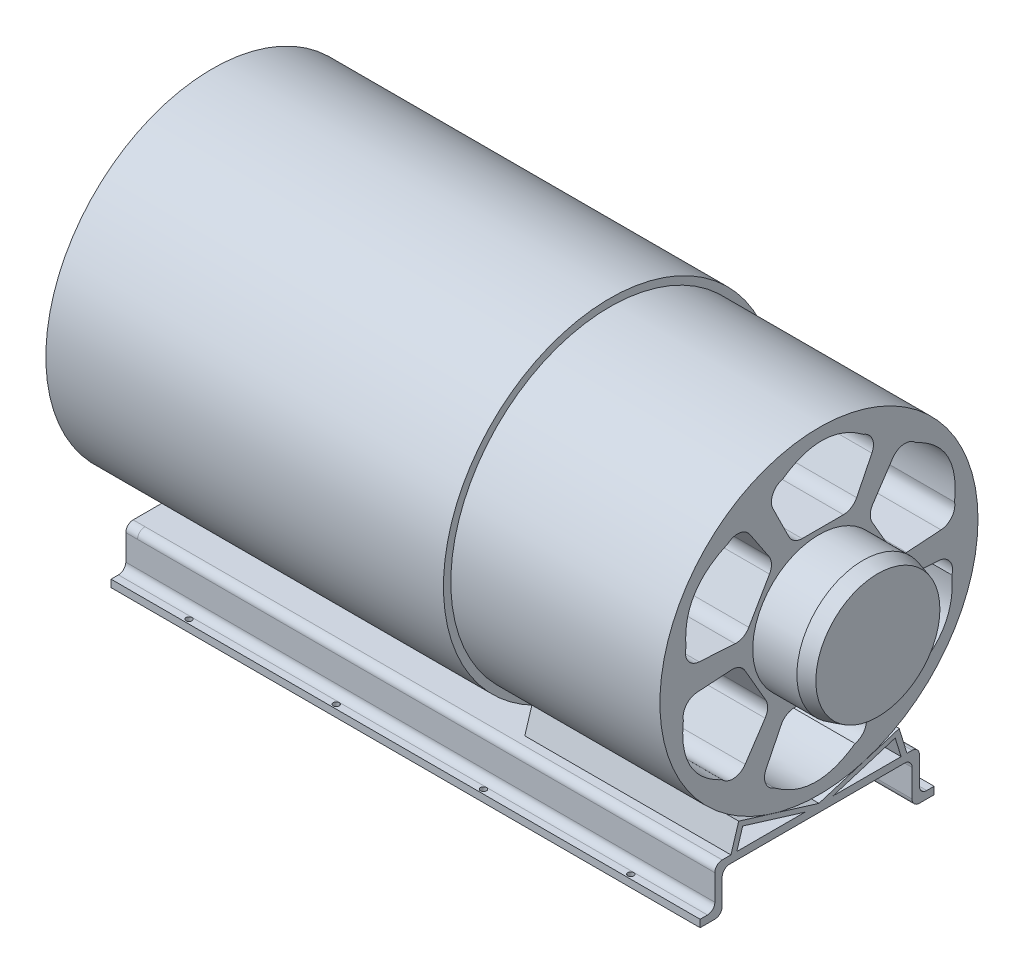
from build123d import *

# Parameters (mm, degrees)
SKETCH1_R           = 113
BOSS_EXTRUDE1_DEPTH = 412
SKETCH2_R           = 113
SKETCH2_R_2         = 108
CUT_EXTRUDE1_DEPTH  = 142
SKETCH3_R           = 45
BOSS_EXTRUDE2_DEPTH = 40
CHAMFER1_SIZE       = 10
CHAMFER1_SIZE2      = 2.867453858
CUT_EXTRUDE2_DEPTH  = 140
BOSS_EXTRUDE3_DEPTH = 140
SKETCH7_W           = 142
SKETCH7_H           = 138.914782262
BOSS_EXTRUDE4_DEPTH = 5
SKETCH8_W           = 250
SKETCH8_H           = 138.4150888
BOSS_EXTRUDE5_DEPTH = 5
BOSS_EXTRUDE6_DEPTH = 400
FILLET1_R           = 5
FILLET2_R           = 5
CUT_EXTRUDE3_REACH  = 502.151
SKETCH12_R          = 2


with BuildPart() as part:
    # Sketch1 → Boss-Extrude1 (new body)
    with BuildSketch(Plane(origin=(0, 0, 0), x_dir=(0, 0, -1), z_dir=(1, 0, 0))):
        Circle(SKETCH1_R)
    extrude(amount=-BOSS_EXTRUDE1_DEPTH)

    # Sketch2 → Cut-Extrude1 (cut)
    with BuildSketch(Plane(origin=(0, 0, 0), x_dir=(0, 0, -1), z_dir=(1, 0, 0))):
        Circle(SKETCH2_R)
        Circle(SKETCH2_R_2, mode=Mode.SUBTRACT)
    extrude(amount=-CUT_EXTRUDE1_DEPTH, mode=Mode.SUBTRACT)

    # Sketch3 → Boss-Extrude2 (add)
    with BuildSketch(Plane(origin=(0, 0, 0), x_dir=(0, 0, -1), z_dir=(1, 0, 0))):
        Circle(SKETCH3_R)
    extrude(amount=BOSS_EXTRUDE2_DEPTH)

    # Chamfer1
    chamfer1_edges = [part.edges().sort_by_distance(p)[0] for p in [
        (40, 0, 45),
    ]]
    chamfer1_side = [part.faces().sort_by_distance(p)[0] for p in [
        (20, 0, 45),
    ]]
    chamfer(chamfer1_edges, length=CHAMFER1_SIZE, length2=CHAMFER1_SIZE2, reference=chamfer1_side[0])

    # Sketch4 → Cut-Extrude2 (cut)
    with BuildSketch(Plane(origin=(0, 0, 0), x_dir=(0, 0, -1), z_dir=(1, 0, 0))):
        with BuildLine():
            Line((-31.240221824, 75.878671681), (-20.391979299, 53.964467826))
            ThreePointArc((-20.391979299, 53.964467826), (-16.704207466, 49.904928956), (-11.429970689, 48.400953109))
            Line((-11.429970689, 48.400953109), (16.62476497, 48.400953109))
            ThreePointArc((16.62476497, 48.400953109), (21.903878294, 49.907958201), (25.591861486, 53.974760608))
            Line((25.591861486, 53.974760608), (35.957582706, 74.974846485))
            ThreePointArc((35.957582706, 74.974846485), (36.256624475, 83.161182767), (30.33757525, 88.824254723))
            add(Edge.make_bspline(
                [(30.33757525, 88.824254723), (20.523446482, 96.066070343), (2.175661832, 102.649387038), (-16.006435429, 96.044513788), (-24.473320343, 90.07125786)],
                knots=[0.076116655, 0.076116655, 0.076116655, 0.076116655, 0.512928547, 0.896674248, 0.896674248, 0.896674248, 0.896674248], degree=3))
            ThreePointArc((-24.473320343, 90.07125786), (-31.304712176, 84.618913054), (-31.240221824, 75.878671681))
        make_face()
        with BuildLine():
            Line((50.092746369, 64.994161559), (36.538610389, 44.64220602))
            ThreePointArc((36.538610389, 44.64220602), (34.866832517, 39.418732494), (36.201469615, 34.099121536))
            Line((36.201469615, 34.099121536), (50.228837445, 9.803007759))
            ThreePointArc((50.228837445, 9.803007759), (54.173498801, 5.984664057), (59.539444593, 4.824178127))
            Line((59.539444593, 4.824178127), (82.908913054, 6.347243161))
            ThreePointArc((82.908913054, 6.347243161), (90.148009123, 10.181433532), (92.092848687, 18.139016506))
            add(Edge.make_bspline(
                [(92.092848687, 18.139016506), (93.4573806, 30.259209145), (89.984807774, 49.440515103), (75.17377112, 61.884236599), (65.767337287, 66.230146062)],
                knots=[0.076116655, 0.076116655, 0.076116655, 0.076116655, 0.512928547, 0.896674248, 0.896674248, 0.896674248, 0.896674248], degree=3))
            ThreePointArc((65.767337287, 66.230146062), (57.629772257, 69.42013253), (50.092746369, 64.994161559))
        make_face()
        with BuildLine():
            Line((81.332968193, -10.884510121), (56.930589688, -9.322261806))
            ThreePointArc((56.930589688, -9.322261806), (51.571039983, -10.486196462), (47.631440305, -14.301831573))
            Line((47.631440305, -14.301831573), (33.604072475, -38.59794535))
            ThreePointArc((33.604072475, -38.59794535), (32.269620506, -43.923294145), (33.947583107, -49.150582481))
            Line((33.947583107, -49.150582481), (46.951330348, -68.627603324))
            ThreePointArc((46.951330348, -68.627603324), (53.891384648, -72.979749235), (61.755273437, -70.685238217))
            add(Edge.make_bspline(
                [(61.755273437, -70.685238217), (72.933934118, -65.806861198), (87.809145942, -53.208871936), (91.180206549, -34.160277188), (90.240657629, -23.841111799)],
                knots=[0.076116655, 0.076116655, 0.076116655, 0.076116655, 0.512928547, 0.896674248, 0.896674248, 0.896674248, 0.896674248], degree=3))
            ThreePointArc((90.240657629, -23.841111799), (88.934484433, -15.198780524), (81.332968193, -10.884510121))
        make_face()
        with BuildLine():
            Line((31.240221824, -75.878671681), (20.391979299, -53.964467826))
            ThreePointArc((20.391979299, -53.964467826), (16.704207466, -49.904928956), (11.429970689, -48.400953109))
            Line((11.429970689, -48.400953109), (-16.62476497, -48.400953109))
            ThreePointArc((-16.62476497, -48.400953109), (-21.903878294, -49.907958201), (-25.591861486, -53.974760608))
            Line((-25.591861486, -53.974760608), (-35.957582706, -74.974846485))
            ThreePointArc((-35.957582706, -74.974846485), (-36.256624475, -83.161182767), (-30.33757525, -88.824254723))
            add(Edge.make_bspline(
                [(-30.33757525, -88.824254723), (-20.523446482, -96.066070343), (-2.175661832, -102.649387038), (16.006435429, -96.044513788), (24.473320343, -90.07125786)],
                knots=[0.076116655, 0.076116655, 0.076116655, 0.076116655, 0.512928547, 0.896674248, 0.896674248, 0.896674248, 0.896674248], degree=3))
            ThreePointArc((24.473320343, -90.07125786), (31.304712176, -84.618913054), (31.240221824, -75.878671681))
        make_face()
        with BuildLine():
            Line((-50.092746369, -64.994161559), (-36.538610389, -44.64220602))
            ThreePointArc((-36.538610389, -44.64220602), (-34.866832517, -39.418732494), (-36.201469615, -34.099121536))
            Line((-36.201469615, -34.099121536), (-50.228837445, -9.803007759))
            ThreePointArc((-50.228837445, -9.803007759), (-54.173498801, -5.984664057), (-59.539444593, -4.824178127))
            Line((-59.539444593, -4.824178127), (-82.908913054, -6.347243161))
            ThreePointArc((-82.908913054, -6.347243161), (-90.148009123, -10.181433532), (-92.092848687, -18.139016506))
            add(Edge.make_bspline(
                [(-92.092848687, -18.139016506), (-93.4573806, -30.259209145), (-89.984807774, -49.440515103), (-75.17377112, -61.884236599), (-65.767337287, -66.230146062)],
                knots=[0.076116655, 0.076116655, 0.076116655, 0.076116655, 0.512928547, 0.896674248, 0.896674248, 0.896674248, 0.896674248], degree=3))
            ThreePointArc((-65.767337287, -66.230146062), (-57.629772257, -69.42013253), (-50.092746369, -64.994161559))
        make_face()
        with BuildLine():
            Line((-81.332968193, 10.884510121), (-56.930589688, 9.322261806))
            ThreePointArc((-56.930589688, 9.322261806), (-51.571039983, 10.486196462), (-47.631440305, 14.301831573))
            Line((-47.631440305, 14.301831573), (-33.604072475, 38.59794535))
            ThreePointArc((-33.604072475, 38.59794535), (-32.269620506, 43.923294145), (-33.947583107, 49.150582481))
            Line((-33.947583107, 49.150582481), (-46.951330348, 68.627603324))
            ThreePointArc((-46.951330348, 68.627603324), (-53.891384648, 72.979749235), (-61.755273437, 70.685238217))
            add(Edge.make_bspline(
                [(-61.755273437, 70.685238217), (-72.933934118, 65.806861198), (-87.809145942, 53.208871936), (-91.180206549, 34.160277188), (-90.240657629, 23.841111799)],
                knots=[0.076116655, 0.076116655, 0.076116655, 0.076116655, 0.512928547, 0.896674248, 0.896674248, 0.896674248, 0.896674248], degree=3))
            ThreePointArc((-90.240657629, 23.841111799), (-88.934484433, 15.198780524), (-81.332968193, 10.884510121))
        make_face()
    extrude(amount=-CUT_EXTRUDE2_DEPTH, mode=Mode.SUBTRACT)


with BuildPart() as body_2:
    # Sketch5 → Boss-Extrude3 (new body)
    with BuildSketch(Plane(origin=(0, 0, 0), x_dir=(0, 0, -1), z_dir=(1, 0, 0))):
        Polygon((0, -113), (54.477876692, -96.232145303), (59.772988702, -113.435685311), (55.772988702, -113.435685311), (51.773497736, -100.44154983), (0, -116.377018316), (-51.773497736, -100.44154983), (-55.772988702, -113.435685311), (-59.772988702, -113.435685311), (-54.477876692, -96.232145303), align=None)
    extrude(amount=-BOSS_EXTRUDE3_DEPTH)

    # Sketch7 → Boss-Extrude4 (add)
    with BuildSketch(Plane.XZ.offset(113.435685311)):
        with Locations((-71, 1.249233653)):
            Rectangle(SKETCH7_W, SKETCH7_H)
    extrude(amount=BOSS_EXTRUDE4_DEPTH)

    # Sketch8 → Boss-Extrude5 (add)
    with BuildSketch(Plane.XZ.offset(118.435685311)):
        with Locations((-267, 1.499080384)):
            Rectangle(SKETCH8_W, SKETCH8_H)
    extrude(amount=-BOSS_EXTRUDE5_DEPTH)

    # Sketch11 → Boss-Extrude6 (add)
    with BuildSketch(Plane(origin=(0, 0, 0), x_dir=(0, 0, -1), z_dir=(1, 0, 0))):
        with BuildLine():
            Line((-65.706624784, -113.435685311), (63.208157478, -113.435685311))
            ThreePointArc((63.208157478, -113.435685311), (66.743691384, -114.900151405), (68.208157478, -118.435685311))
            Line((68.208157478, -118.435685311), (68.208157478, -137.07346832))
            ThreePointArc((68.208157478, -137.07346832), (69.672623572, -140.609002226), (73.208157478, -142.07346832))
            Line((73.208157478, -142.07346832), (78.208157478, -142.07346832))
            Line((78.208157478, -142.07346832), (78.208157478, -147.07346832))
            Line((78.208157478, -147.07346832), (68.208157478, -147.07346832))
            ThreePointArc((68.208157478, -147.07346832), (64.672623572, -145.609002226), (63.208157478, -142.07346832))
            Line((63.208157478, -142.07346832), (63.208157478, -123.435685311))
            ThreePointArc((63.208157478, -123.435685311), (61.743691384, -119.900151405), (58.208157478, -118.435685311))
            Line((58.208157478, -118.435685311), (-60.706624784, -118.435685311))
            ThreePointArc((-60.706624784, -118.435685311), (-64.24215869, -119.900151405), (-65.706624784, -123.435685311))
            Line((-65.706624784, -123.435685311), (-65.706624784, -140.815001681))
            ThreePointArc((-65.706624784, -140.815001681), (-67.171090879, -144.350535587), (-70.706624784, -145.815001681))
            Line((-70.706624784, -145.815001681), (-80.706624784, -145.815001681))
            Line((-80.706624784, -145.815001681), (-80.706624784, -140.815001681))
            Line((-80.706624784, -140.815001681), (-75.706624784, -140.815001681))
            ThreePointArc((-75.706624784, -140.815001681), (-72.171090879, -139.350535587), (-70.706624784, -135.815001681))
            Line((-70.706624784, -135.815001681), (-70.706624784, -118.435685311))
            ThreePointArc((-70.706624784, -118.435685311), (-69.24215869, -114.900151405), (-65.706624784, -113.435685311))
        make_face()
    extrude(amount=-BOSS_EXTRUDE6_DEPTH)

    # Fillet1
    fillet1_edges = [body_2.edges().sort_by_distance(p)[0] for p in [
        (-71, -113.435685311, -68.208157478),
    ]]
    fillet(fillet1_edges, radius=FILLET1_R - 0.0001)  # a hair under: the kernel refuses the full size

    # Fillet2
    fillet2_edges = [body_2.edges().sort_by_distance(p)[0] for p in [
        (-196, -113.435685311, 70.706624784),
    ]]
    fillet(fillet2_edges, radius=FILLET2_R)

    # Cut-Extrude3: up to this face of the body (flat: up to its plane)
    cut_extrude3_end = Plane(body_2.part.faces().sort_by_distance((-200, -140.815001681, 78.206624784))[0])
    # Sketch12 → Cut-Extrude3 (cut, up to the picked face)
    with BuildSketch(Plane.XZ.offset(147.07346832), mode=Mode.PRIVATE) as cut_extrude3_sk1:
        with Locations(Location((-350, -73.208157478, 0), (0, 0, 270))):
            Circle(SKETCH12_R)
    cut_extrude3_tool1 = split(extrude(cut_extrude3_sk1.sketch, amount=-CUT_EXTRUDE3_REACH, mode=Mode.PRIVATE), bisect_by=cut_extrude3_end, keep=Keep.BOTH, mode=Mode.PRIVATE)
    # Sketch12 → Cut-Extrude3 (cut, up to the picked face)
    with BuildSketch(Plane.XZ.offset(147.07346832), mode=Mode.PRIVATE) as cut_extrude3_sk2:
        with Locations(Location((-250, -73.208157478, 0), (0, 0, 270))):
            Circle(SKETCH12_R)
    cut_extrude3_tool2 = split(extrude(cut_extrude3_sk2.sketch, amount=-CUT_EXTRUDE3_REACH, mode=Mode.PRIVATE), bisect_by=cut_extrude3_end, keep=Keep.BOTH, mode=Mode.PRIVATE)
    # Sketch12 → Cut-Extrude3 (cut, up to the picked face)
    with BuildSketch(Plane.XZ.offset(147.07346832), mode=Mode.PRIVATE) as cut_extrude3_sk3:
        with Locations(Location((-150, -73.208157478, 0), (0, 0, 270))):
            Circle(SKETCH12_R)
    cut_extrude3_tool3 = split(extrude(cut_extrude3_sk3.sketch, amount=-CUT_EXTRUDE3_REACH, mode=Mode.PRIVATE), bisect_by=cut_extrude3_end, keep=Keep.BOTH, mode=Mode.PRIVATE)
    # Sketch12 → Cut-Extrude3 (cut, up to the picked face)
    with BuildSketch(Plane.XZ.offset(147.07346832), mode=Mode.PRIVATE) as cut_extrude3_sk4:
        with Locations(Location((-50, -73.208157478, 0), (0, 0, 270))):
            Circle(SKETCH12_R)
    cut_extrude3_tool4 = split(extrude(cut_extrude3_sk4.sketch, amount=-CUT_EXTRUDE3_REACH, mode=Mode.PRIVATE), bisect_by=cut_extrude3_end, keep=Keep.BOTH, mode=Mode.PRIVATE)
    # Sketch12 → Cut-Extrude3 (cut, up to the picked face)
    with BuildSketch(Plane.XZ.offset(147.07346832), mode=Mode.PRIVATE) as cut_extrude3_sk5:
        with Locations(Location((-350, 77.791842522, 0), (0, 0, 270))):
            Circle(SKETCH12_R)
    cut_extrude3_tool5 = split(extrude(cut_extrude3_sk5.sketch, amount=-CUT_EXTRUDE3_REACH, mode=Mode.PRIVATE), bisect_by=cut_extrude3_end, keep=Keep.BOTH, mode=Mode.PRIVATE)
    # Sketch12 → Cut-Extrude3 (cut, up to the picked face)
    with BuildSketch(Plane.XZ.offset(147.07346832), mode=Mode.PRIVATE) as cut_extrude3_sk6:
        with Locations(Location((-250, 77.791842522, 0), (0, 0, 270))):
            Circle(SKETCH12_R)
    cut_extrude3_tool6 = split(extrude(cut_extrude3_sk6.sketch, amount=-CUT_EXTRUDE3_REACH, mode=Mode.PRIVATE), bisect_by=cut_extrude3_end, keep=Keep.BOTH, mode=Mode.PRIVATE)
    # Sketch12 → Cut-Extrude3 (cut, up to the picked face)
    with BuildSketch(Plane.XZ.offset(147.07346832), mode=Mode.PRIVATE) as cut_extrude3_sk7:
        with Locations(Location((-150, 77.791842522, 0), (0, 0, 270))):
            Circle(SKETCH12_R)
    cut_extrude3_tool7 = split(extrude(cut_extrude3_sk7.sketch, amount=-CUT_EXTRUDE3_REACH, mode=Mode.PRIVATE), bisect_by=cut_extrude3_end, keep=Keep.BOTH, mode=Mode.PRIVATE)
    # Sketch12 → Cut-Extrude3 (cut, up to the picked face)
    with BuildSketch(Plane.XZ.offset(147.07346832), mode=Mode.PRIVATE) as cut_extrude3_sk8:
        with Locations(Location((-50, 77.791842522, 0), (0, 0, 270))):
            Circle(SKETCH12_R)
    cut_extrude3_tool8 = split(extrude(cut_extrude3_sk8.sketch, amount=-CUT_EXTRUDE3_REACH, mode=Mode.PRIVATE), bisect_by=cut_extrude3_end, keep=Keep.BOTH, mode=Mode.PRIVATE)
    add(cut_extrude3_tool1.solids().sort_by(Axis((-350, -147.073468, -73.208157), (0, 1, 0)))[0], mode=Mode.SUBTRACT)
    add(cut_extrude3_tool2.solids().sort_by(Axis((-250, -147.073468, -73.208157), (0, 1, 0)))[0], mode=Mode.SUBTRACT)
    add(cut_extrude3_tool3.solids().sort_by(Axis((-150, -147.073468, -73.208157), (0, 1, 0)))[0], mode=Mode.SUBTRACT)
    add(cut_extrude3_tool4.solids().sort_by(Axis((-50, -147.073468, -73.208157), (0, 1, 0)))[0], mode=Mode.SUBTRACT)
    add(cut_extrude3_tool5.solids().sort_by(Axis((-350, -147.073468, 77.791843), (0, 1, 0)))[0], mode=Mode.SUBTRACT)
    add(cut_extrude3_tool6.solids().sort_by(Axis((-250, -147.073468, 77.791843), (0, 1, 0)))[0], mode=Mode.SUBTRACT)
    add(cut_extrude3_tool7.solids().sort_by(Axis((-150, -147.073468, 77.791843), (0, 1, 0)))[0], mode=Mode.SUBTRACT)
    add(cut_extrude3_tool8.solids().sort_by(Axis((-50, -147.073468, 77.791843), (0, 1, 0)))[0], mode=Mode.SUBTRACT)


solid = Compound([part.part, body_2.part])
